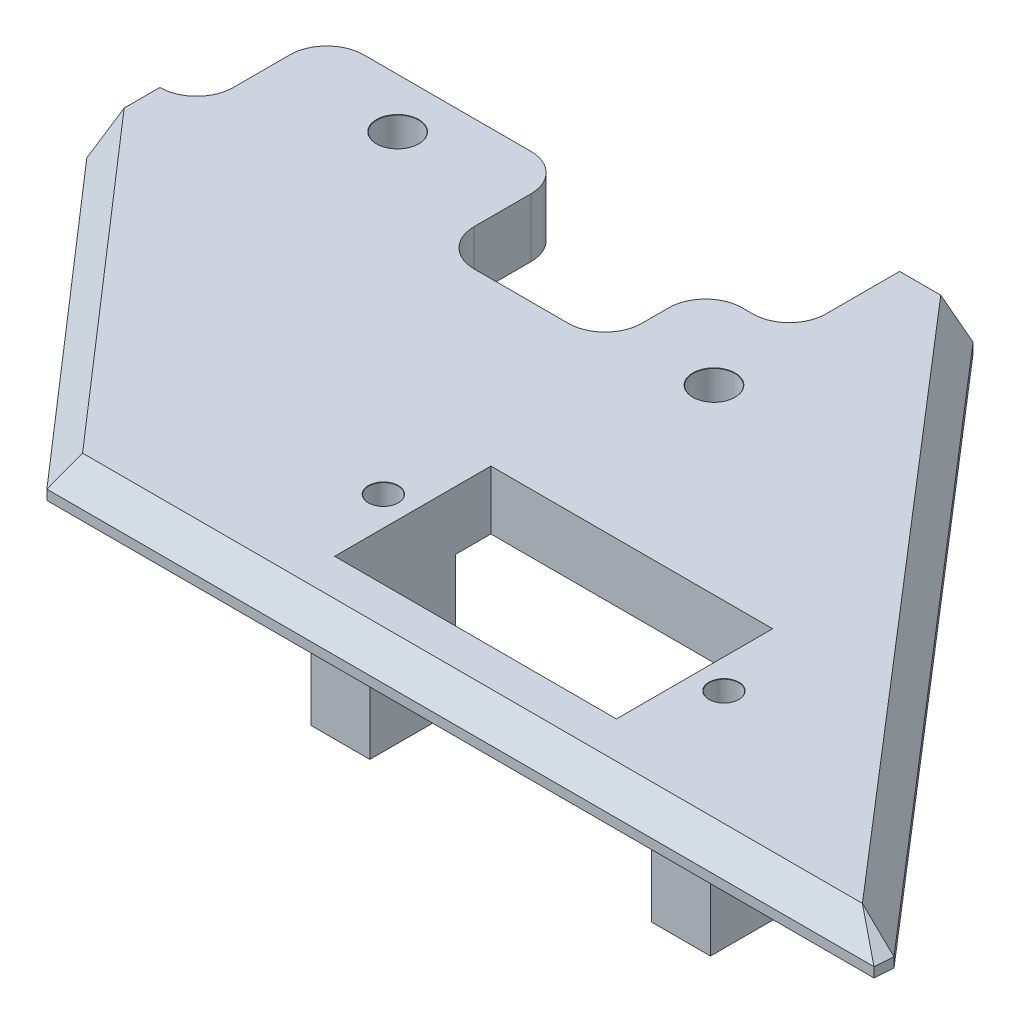
from build123d import *

# Parameters (mm, degrees)
BOSS_EXTRUDE1_DEPTH            = 4.8
BOSS_EXTRUDE3_DEPTH            = 4.8
M3_CLEARANCE_HOLE2_D           = 3.4
M3_CLEARANCE_HOLE2_CSINK_D     = 3.45
M3_CLEARANCE_HOLE2_CSINK_ANGLE = 90
BOSS_EXTRUDE4_DEPTH            = 4.8
SKETCH11_W                     = 23
SKETCH11_H                     = 12.75
CUT_EXTRUDE1_DEPTH             = 4.8
M2_CLEARANCE_HOLE1_D           = 2.4
M2_CLEARANCE_HOLE1_CSINK_D     = 2.45
M2_CLEARANCE_HOLE1_CSINK_ANGLE = 90
CUT_EXTRUDE2_DEPTH             = 4.8
SKETCH16_W                     = 4.8
SKETCH16_H                     = 7
BOSS_EXTRUDE6_DEPTH            = 11
SKETCH17_R                     = 1.225
CUT_EXTRUDE3_DEPTH             = 11
CUT_EXTRUDE4_DEPTH             = 1.75


with BuildPart() as part:
    # Sketch1 → Boss-Extrude1 (new body)
    with BuildSketch(Plane(origin=(0, 0, 0), x_dir=(1, 0, 0), z_dir=(0, 1, 0))):
        with BuildLine():
            Line((6.83, 0), (-6.83, 0))
            ThreePointArc((-6.83, 0), (-8.951320344, -0.878679656), (-9.83, -3))
            Line((-9.83, -3), (-9.83, -7.63))
            ThreePointArc((-9.83, -7.63), (-10.708679656, -9.751320344), (-12.83, -10.63))
            Line((-12.83, -10.63), (-12.83, -16.63))
            Line((-12.83, -16.63), (12.83, -16.63))
            Line((12.83, -16.63), (12.83, -10.63))
            ThreePointArc((12.83, -10.63), (10.708679656, -9.751320344), (9.83, -7.63))
            Line((9.83, -7.63), (9.83, -3))
            ThreePointArc((9.83, -3), (8.951320344, -0.878679656), (6.83, 0))
        make_face()
    extrude(amount=BOSS_EXTRUDE1_DEPTH)

    # Sketch9 → Boss-Extrude3 (add)
    with BuildSketch(Plane(origin=(0, 4.8, 0), x_dir=(1, 0, 0), z_dir=(0, 1, 0))):
        with BuildLine():
            Line((12.83, -16.63), (12.83, -10.63))
            Line((12.83, -10.63), (20.51, -10.63))
            ThreePointArc((20.51, -10.63), (22.631320344, -9.751320344), (23.51, -7.63))
            Line((23.51, -7.63), (23.51, -5.44))
            ThreePointArc((23.51, -5.44), (24.388679656, -3.318679656), (26.51, -2.44))
            Line((26.51, -2.44), (27.36, -2.44))
            ThreePointArc((27.36, -2.44), (29.481320344, -1.561320344), (30.36, 0.56))
            Line((30.36, 0.56), (30.36, 6.56))
            Line((30.36, 6.56), (36.36, 6.56))
            Line((36.36, 6.56), (36.36, -16.63))
            Line((36.36, -16.63), (12.83, -16.63))
        make_face()
    extrude(amount=-BOSS_EXTRUDE3_DEPTH)

    # M3 Clearance Hole2 (through all)
    with Locations(Plane(origin=(0, 4.8, 0), x_dir=(1, 0, 0), z_dir=(0, 1, 0))):
        with Locations((0, -4.05), (30.821320344, -9.051320344)):
            CounterSinkHole(M3_CLEARANCE_HOLE2_D / 2, M3_CLEARANCE_HOLE2_CSINK_D / 2, counter_sink_angle=M3_CLEARANCE_HOLE2_CSINK_ANGLE)

    # Sketch10 → Boss-Extrude4 (add)
    with BuildSketch(Plane(origin=(0, 4.8, 0), x_dir=(1, 0, 0), z_dir=(0, 1, 0))):
        Polygon((-12.83, -16.63), (-12.83, -41.63), (77.88, -41.63), (77.88, 6.56), (36.36, 6.56), (36.36, -16.63), align=None)
    extrude(amount=-BOSS_EXTRUDE4_DEPTH)

    # Sketch11 → Cut-Extrude1 (cut)
    with BuildSketch(Plane(origin=(0, 4.8, 0), x_dir=(1, 0, 0), z_dir=(0, 1, 0))):
        with Locations((38.94, -30.255)):
            Rectangle(SKETCH11_W, SKETCH11_H)
    extrude(amount=-CUT_EXTRUDE1_DEPTH, mode=Mode.SUBTRACT)

    # M2 Clearance Hole1 (through all)
    with Locations(Plane(origin=(0, 4.8, 0), x_dir=(1, 0, 0), z_dir=(0, 1, 0))):
        with Locations((25.04, -30.255), (52.84, -30.255)):
            CounterSinkHole(M2_CLEARANCE_HOLE1_D / 2, M2_CLEARANCE_HOLE1_CSINK_D / 2, counter_sink_angle=M2_CLEARANCE_HOLE1_CSINK_ANGLE)

    # Sketch14 → Cut-Extrude2 (cut)
    with BuildSketch(Plane(origin=(0, 4.8, 0), x_dir=(1, 0, 0), z_dir=(0, 1, 0))):
        Polygon((-12.83, -16.59), (8.952290106, -41.63), (-12.83, -41.63), align=None)
        Polygon((36.36, 6.56), (77.88, -41.63), (77.88, 6.56), align=None)
    extrude(amount=-CUT_EXTRUDE2_DEPTH, mode=Mode.SUBTRACT)

    # Chamfer2
    # the kernel refuses this chamfer: 2, 1.418117079 mm, written as the material it takes off along each edge
    with BuildSketch(Plane(origin=(75.517763148, 3.466666667, 40.45827363), x_dir=(-0.07414602746519786, 0, 0.9972473948881141), z_dir=(0.5424620475376688, 0.83911156735298, 0.040332425115101794))) as chamfer2_piece_1:
        Polygon((-0.420862971, 1.22558177), (1.098498339, 1.22558177), (-0.677635367, -2.451163541), align=None)
    extrude(amount=2.692247612, mode=Mode.SUBTRACT)
    with BuildSketch(Plane(origin=(75.517763148, 1.333333333, 40.45827363), x_dir=(-0.07414602746519786, 0, 0.9972473948881141), z_dir=(0.5424620475376688, -0.83911156735298, 0.040332425115102044))) as chamfer2_piece_2:
        Polygon((-0.420862971, -1.22558177), (1.098498339, -1.22558177), (-0.677635367, 2.451163541), align=None)
    extrude(amount=2.692247612, mode=Mode.SUBTRACT)
    with BuildSketch(Plane(origin=(3.80892413, 4.8, 41.63), x_dir=(0, 0.02749587661058651, -0.9996219169112968), z_dir=(1, 0, 0))) as chamfer2_piece_3:
        with BuildLine():
            Line((2.05734639, 0), (-0.11309431, -2.054235587))
            Line((-0.11309431, -2.054235587), (-0.153079186, -2.053135752))
            ThreePointArc((-0.153079186, -2.053135752), (-0.068258454, -1.026795659), (-0.039984877, 0.001099835))
            Line((-0.039984877, 0.001099835), (0.001099835, 0.039984877))
            ThreePointArc((0.001099835, 0.039984877), (1.028995329, 0.011711299), (2.058446225, 0.039984877))
            Line((2.058446225, 0.039984877), (2.05734639, 0))
        make_face()
    extrude(amount=79.214441846, mode=Mode.SUBTRACT)
    with BuildSketch(Plane(origin=(-16.205706468, 4.8, 12.709430531), x_dir=(0.7541952701172161, 0.027495876610586487, -0.6560742879447683), z_dir=(0.6563224323571792, 0, 0.754480526445021))) as chamfer2_piece_4:
        with BuildLine():
            Line((2.05734639, 0), (-0.11309431, -2.054235587))
            Line((-0.11309431, -2.054235587), (-0.153079186, -2.053135752))
            ThreePointArc((-0.153079186, -2.053135752), (-0.068258454, -1.026795659), (-0.039984877, 0.001099835))
            Line((-0.039984877, 0.001099835), (0.001099835, 0.039984877))
            ThreePointArc((0.001099835, 0.039984877), (1.028995329, 0.011711299), (2.058446225, 0.039984877))
            Line((2.058446225, 0.039984877), (2.05734639, 0))
        make_face()
    extrude(amount=43.475129959, mode=Mode.SUBTRACT)
    with BuildSketch(Plane(origin=(-16.205706468, 0, 12.709430531), x_dir=(0.7541952701172161, -0.02749587661058636, -0.6560742879447683), z_dir=(0.6563224323571792, 0, 0.754480526445021))) as chamfer2_piece_5:
        with BuildLine():
            Line((2.05734639, 0), (-0.11309431, 2.054235587))
            Line((-0.11309431, 2.054235587), (-0.153079186, 2.053135752))
            ThreePointArc((-0.153079186, 2.053135752), (-0.068258454, 1.026795659), (-0.039984877, -0.001099835))
            Line((-0.039984877, -0.001099835), (0.001099835, -0.039984877))
            ThreePointArc((0.001099835, -0.039984877), (1.028995329, -0.011711299), (2.058446225, -0.039984877))
            Line((2.058446225, -0.039984877), (2.05734639, 0))
        make_face()
    extrude(amount=43.475129959, mode=Mode.SUBTRACT)
    with BuildSketch(Plane(origin=(33.002764366, 4.8, -10.456560337), x_dir=(-0.7573031224660502, 0.027495876610586473, 0.6524844499852744), z_dir=(0.6527312366273116, 0, 0.757589554264696))) as chamfer2_piece_6:
        with BuildLine():
            Line((2.05734639, 0), (-0.11309431, 2.054235587))
            Line((-0.11309431, 2.054235587), (-0.153079186, 2.053135752))
            ThreePointArc((-0.153079186, 2.053135752), (-0.068258454, 1.026795659), (-0.039984877, -0.001099835))
            Line((-0.039984877, -0.001099835), (0.001099835, -0.039984877))
            ThreePointArc((0.001099835, -0.039984877), (1.028995329, -0.011711299), (2.058446225, -0.039984877))
            Line((2.058446225, -0.039984877), (2.05734639, 0))
        make_face()
    extrude(amount=73.896373517, mode=Mode.SUBTRACT)
    with BuildSketch(Plane(origin=(33.002764366, 0, -10.456560337), x_dir=(-0.7573031224660502, -0.02749587661058634, 0.6524844499852744), z_dir=(0.6527312366273116, 0, 0.757589554264696))) as chamfer2_piece_7:
        with BuildLine():
            Line((2.05734639, 0), (-0.11309431, -2.054235587))
            Line((-0.11309431, -2.054235587), (-0.153079186, -2.053135752))
            ThreePointArc((-0.153079186, -2.053135752), (-0.068258454, -1.026795659), (-0.039984877, 0.001099835))
            Line((-0.039984877, 0.001099835), (0.001099835, 0.039984877))
            ThreePointArc((0.001099835, 0.039984877), (1.028995329, 0.011711299), (2.058446225, 0.039984877))
            Line((2.058446225, 0.039984877), (2.05734639, 0))
        make_face()
    extrude(amount=73.896373517, mode=Mode.SUBTRACT)
    with BuildSketch(Plane(origin=(77.88, 9.943365976, 41.63), x_dir=(-0.6316538610797438, 0, -0.7752505400082296), z_dir=(0, -1, 0))) as chamfer2_piece_8:
        with BuildLine():
            Line((2.05734639, 0), (0.837656572, -1.154387784))
            Line((0.837656572, -1.154387784), (0.80664655, -1.179653939))
            ThreePointArc((0.80664655, -1.179653939), (0.418742927, -0.57726344), (-0.031010022, -0.025266154))
            Line((-0.031010022, -0.025266154), (0.001099835, 0.039984877))
            ThreePointArc((0.001099835, 0.039984877), (1.028995329, 0.011711299), (2.058446225, 0.039984877))
            Line((2.058446225, 0.039984877), (2.05734639, 0))
        make_face()
    extrude(amount=15.086731952, mode=Mode.SUBTRACT)
    with BuildSketch(Plane(origin=(3.80892413, 0, 41.63), x_dir=(0, -0.02749587661058639, -0.9996219169112968), z_dir=(1, 0, 0))) as chamfer2_piece_9:
        with BuildLine():
            Line((2.05734639, 0), (-0.11309431, 2.054235587))
            Line((-0.11309431, 2.054235587), (-0.153079186, 2.053135752))
            ThreePointArc((-0.153079186, 2.053135752), (-0.068258454, 1.026795659), (-0.039984877, -0.001099835))
            Line((-0.039984877, -0.001099835), (0.001099835, -0.039984877))
            ThreePointArc((0.001099835, -0.039984877), (1.028995329, -0.011711299), (2.058446225, -0.039984877))
            Line((2.058446225, -0.039984877), (2.05734639, 0))
        make_face()
    extrude(amount=79.214441846, mode=Mode.SUBTRACT)

    # Sketch16 → Boss-Extrude6 (add)
    with BuildSketch(Plane.XZ):
        with Locations((25.04, 30.255)):
            Rectangle(SKETCH16_W, SKETCH16_H)
        with Locations((52.84, 30.255)):
            Rectangle(SKETCH16_W, SKETCH16_H)
    extrude(amount=BOSS_EXTRUDE6_DEPTH)

    # Sketch17 → Cut-Extrude3 (cut)
    with BuildSketch(Plane.XZ.offset(11)):
        with Locations(Location((25.04, 30.255, 0), (0, 0, 270))):
            Circle(SKETCH17_R)
        with Locations(Location((52.84, 30.255, 0), (0, 0, 270))):
            Circle(SKETCH17_R)
    extrude(amount=-CUT_EXTRUDE3_DEPTH, mode=Mode.SUBTRACT)

    # Sketch18 → Cut-Extrude4 (cut)
    with BuildSketch(Plane.XZ.offset(11)):
        Polygon((25.04, 27.945598923), (27.04, 29.100299462), (27.04, 31.409700538), (25.04, 32.564401077), (23.04, 31.409700538), (23.04, 29.100299462), align=None)
        Polygon((52.84, 27.945598923), (54.84, 29.100299462), (54.84, 31.409700538), (52.84, 32.564401077), (50.84, 31.409700538), (50.84, 29.100299462), align=None)
    extrude(amount=-CUT_EXTRUDE4_DEPTH, mode=Mode.SUBTRACT)


solid = part.part
